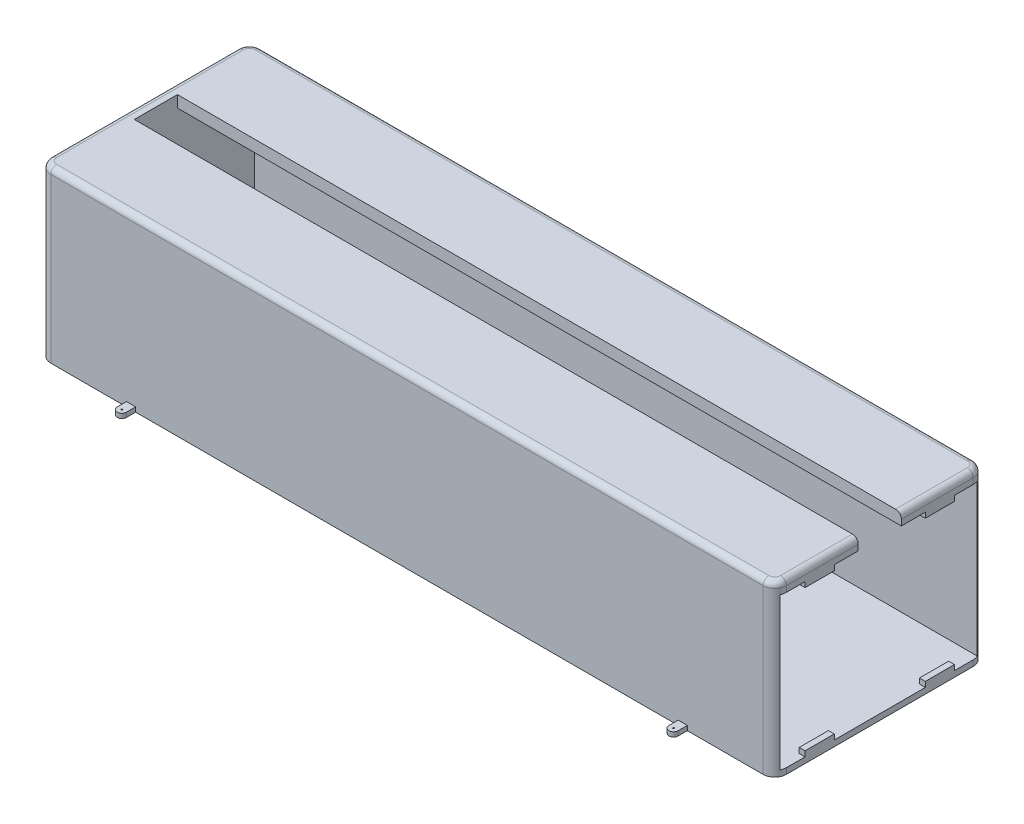
from build123d import *

# Parameters (mm, degrees)
EXTRUDE_1_DEPTH     = 368.3
CUT_EXTRUDE_1_DEPTH = 1574.8
SKETCH_3_W          = 63.5
SKETCH_3_H          = 22.86
EXTRUDE_3_DEPTH     = 12.7
FILLET_1_R          = 12.7
SKETCH_4_R          = 1.5
EXTRUDE_4_DEPTH     = 10


with BuildPart() as part:
    # 草图1 → 凸台-拉伸1 (new body)
    with BuildSketch(Plane(origin=(0, 0, 0), x_dir=(1, 0, 0), z_dir=(0, 1, 0))):
        with BuildLine():
            Line((-774.7, 228.6), (774.7, 228.6))
            ThreePointArc((774.7, 228.6), (792.660512242, 221.160512242), (800.1, 203.2))
            Line((800.1, 203.2), (800.1, -203.2))
            ThreePointArc((800.1, -203.2), (792.660512242, -221.160512242), (774.7, -228.6))
            Line((774.7, -228.6), (-774.7, -228.6))
            ThreePointArc((-774.7, -228.6), (-792.660512242, -221.160512242), (-800.1, -203.2))
            Line((-800.1, -203.2), (-800.1, 203.2))
            ThreePointArc((-800.1, 203.2), (-792.660512242, 221.160512242), (-774.7, 228.6))
        make_face()
    extrude(amount=EXTRUDE_1_DEPTH)

    # 草图2 → 切除-拉伸1 (cut)
    with BuildSketch(Plane(origin=(800.1, 0, 0), x_dir=(0, 0, -1), z_dir=(1, 0, 0))):
        Polygon((-214.63, 342.9), (-46.894283972, 342.9), (-46.894283972, 368.3), (46.894283972, 368.3), (46.894283972, 342.9), (214.63, 342.9), (214.63, 12.7), (-214.63, 12.7), align=None)
    extrude(amount=-CUT_EXTRUDE_1_DEPTH, mode=Mode.SUBTRACT)

    # 草图3 → 凸台-拉伸3 (add)
    with BuildSketch(Plane(origin=(800.1, 0, 0), x_dir=(0, 0, -1), z_dir=(1, 0, 0))):
        with Locations((-130.762141986, 342.9)):
            Rectangle(SKETCH_3_W, SKETCH_3_H)
        with Locations((130.762141986, 342.9)):
            Rectangle(SKETCH_3_W, SKETCH_3_H)
        with Locations((130.762141986, 12.7)):
            Rectangle(SKETCH_3_W, SKETCH_3_H)
        with Locations((-130.762141986, 12.7)):
            Rectangle(SKETCH_3_W, SKETCH_3_H)
    extrude(amount=-EXTRUDE_3_DEPTH)

    # 变化圆角1
    fillet_1_edges = [part.edges().sort_by_distance(p)[0] for p in [
        (800.1, 368.3, 125.047141986),
        (792.660512242, 368.3, 221.160512242),
        (0, 368.3, 228.6),
        (-792.660512242, 368.3, 221.160512242),
        (-800.1, 368.3, 0),
        (-792.660512242, 368.3, -221.160512242),
        (0, 368.3, -228.6),
        (792.660512242, 368.3, -221.160512242),
        (800.1, 368.3, -125.047141986),
    ]]
    fillet(fillet_1_edges, radius=FILLET_1_R)

    # 草图4 → 凸台-拉伸4 (add)
    # profile 1 of 4: a face of its own
    with BuildSketch(Plane.XZ):
        with BuildLine():
            Line((-610.1, 228.6), (-590.1, 228.6))
            Line((-590.1, 228.6), (-590.1, 248.6))
            ThreePointArc((-590.1, 248.6), (-600.1, 258.6), (-610.1, 248.6))
            Line((-610.1, 248.6), (-610.1, 228.6))
        make_face()
        with Locations((-600.1, 248.6)):
            Circle(SKETCH_4_R, mode=Mode.SUBTRACT)
    # profile 2 of 4: a face of its own
    with BuildSketch(Plane.XZ):
        with BuildLine():
            Line((610.1, 228.6), (590.1, 228.6))
            Line((590.1, 228.6), (590.1, 248.6))
            ThreePointArc((590.1, 248.6), (600.1, 258.6), (610.1, 248.6))
            Line((610.1, 248.6), (610.1, 228.6))
        make_face()
        with Locations((600.1, 248.6)):
            Circle(SKETCH_4_R, mode=Mode.SUBTRACT)
    # profile 3 of 4: a face of its own
    with BuildSketch(Plane.XZ):
        with BuildLine():
            Line((610.1, -228.6), (610.1, -248.6))
            ThreePointArc((610.1, -248.6), (600.1, -258.6), (590.1, -248.6))
            Line((590.1, -248.6), (590.1, -228.6))
            Line((590.1, -228.6), (610.1, -228.6))
        make_face()
        with Locations((600.1, -248.6)):
            Circle(SKETCH_4_R, mode=Mode.SUBTRACT)
    # profile 4 of 4: a face of its own
    with BuildSketch(Plane.XZ):
        with BuildLine():
            Line((-610.1, -228.6), (-590.1, -228.6))
            Line((-590.1, -228.6), (-590.1, -248.6))
            ThreePointArc((-590.1, -248.6), (-600.1, -258.6), (-610.1, -248.6))
            Line((-610.1, -248.6), (-610.1, -228.6))
        make_face()
        with Locations((-600.1, -248.6)):
            Circle(SKETCH_4_R, mode=Mode.SUBTRACT)
    extrude(amount=-EXTRUDE_4_DEPTH)


solid = part.part
